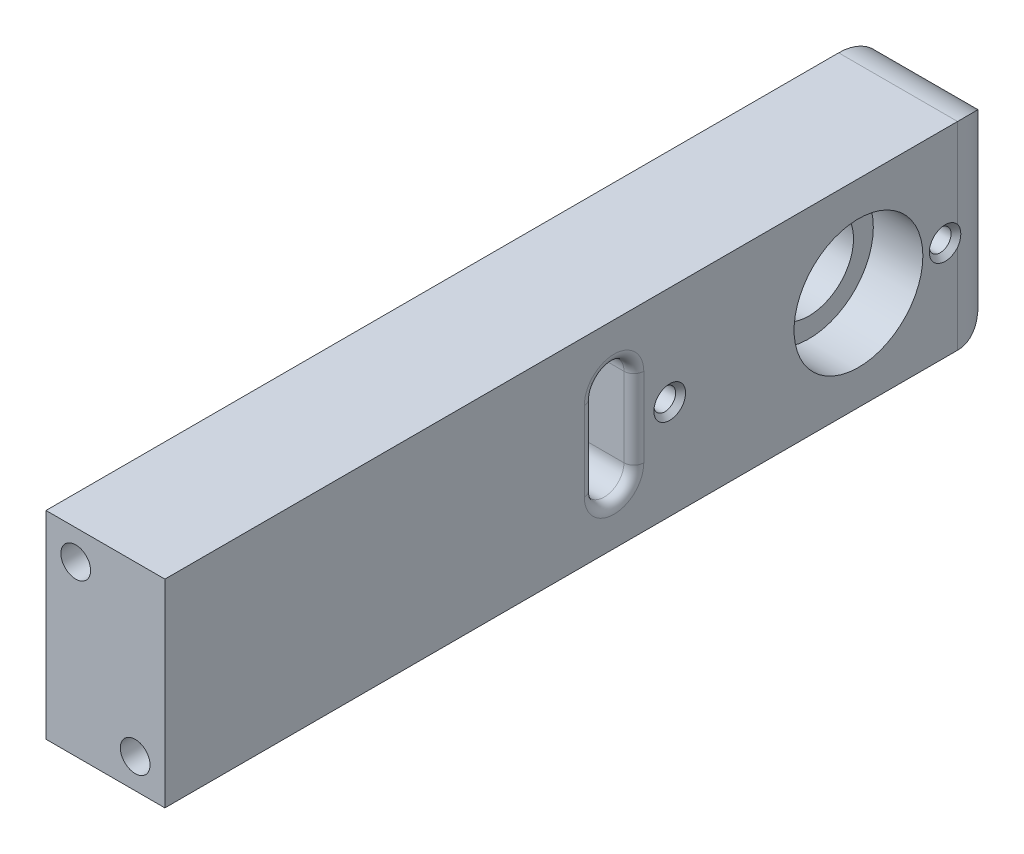
from build123d import *

# Parameters (mm, degrees)
SZKIC1_W                    = 12
SZKIC1_H                    = 20
DODANIE_WYCI_GNI_CIE1_DEPTH = 85
SZKIC2_R                    = 1.5
WYTNIJ_WYCI_GNI_CIE1_DEPTH  = 10
SZKIC4_R                    = 6.5
WYTNIJ_WYCI_GNI_CIE2_DEPTH  = 5
SZKIC5_R                    = 4.5
WYTNIJ_WYCI_GNI_CIE3_DEPTH  = 87.423376467
SZKIC6_R                    = 1.1
WYTNIJ_WYCI_GNI_CIE4_DEPTH  = 87.423376467
SFAZOWANIE1_SIZE            = 0.5
SZKIC7_R                    = 1.1
WYTNIJ_WYCI_GNI_CIE5_DEPTH  = 87.423376467
SFAZOWANIE2_SIZE            = 0.5
ZAOKR_GLENIE1_R             = 5
WYTNIJ_WYCI_GNI_CIE6_DEPTH  = 87.423376493
ZAOKR_GLENIE2_R             = 1


with BuildPart() as part:
    # Szkic1 → Dodanie-wyciągnięcie1 (new body)
    with BuildSketch(Plane.XY):
        Rectangle(SZKIC1_W, SZKIC1_H)
    extrude(amount=DODANIE_WYCI_GNI_CIE1_DEPTH)

    # Szkic2 → Wytnij-wyciągnięcie1 (cut)
    with BuildSketch(Plane.XY.offset(85)):
        with Locations((-3, 7)):
            Circle(SZKIC2_R)
        with Locations((3, -7)):
            Circle(SZKIC2_R)
    extrude(amount=-WYTNIJ_WYCI_GNI_CIE1_DEPTH, mode=Mode.SUBTRACT)

    # Szkic4 → Wytnij-wyciągnięcie2 (cut)
    with BuildSketch(Plane(origin=(6, 0, 0), x_dir=(0, 0, -1), z_dir=(1, 0, 0))):
        with Locations((-15, 0)):
            Circle(SZKIC4_R)
    extrude(amount=-WYTNIJ_WYCI_GNI_CIE2_DEPTH, mode=Mode.SUBTRACT)

    # Szkic5 → Wytnij-wyciągnięcie3 (cut, through all)
    with BuildSketch(Plane.ZY.offset(6)):
        with Locations((15, 0)):
            Circle(SZKIC5_R)
    extrude(amount=-WYTNIJ_WYCI_GNI_CIE3_DEPTH, mode=Mode.SUBTRACT)

    # Szkic6 → Wytnij-wyciągnięcie4 (cut, through all)
    with BuildSketch(Plane.ZY.offset(6)):
        with Locations((34.05, 0)):
            Circle(SZKIC6_R)
    extrude(amount=-WYTNIJ_WYCI_GNI_CIE4_DEPTH, mode=Mode.SUBTRACT)

    # Sfazowanie1
    sfazowanie1_edges = [part.edges().sort_by_distance(p)[0] for p in [
        (6, 0, 32.95),
    ]]
    chamfer(sfazowanie1_edges, length=SFAZOWANIE1_SIZE)

    # Szkic7 → Wytnij-wyciągnięcie5 (cut, through all)
    with BuildSketch(Plane.ZY.offset(6)):
        with Locations((6.25, 0)):
            Circle(SZKIC7_R)
    extrude(amount=-WYTNIJ_WYCI_GNI_CIE5_DEPTH, mode=Mode.SUBTRACT)

    # Sfazowanie2
    sfazowanie2_edges = [part.edges().sort_by_distance(p)[0] for p in [
        (6, 0, 5.15),
    ]]
    chamfer(sfazowanie2_edges, length=SFAZOWANIE2_SIZE)

    # Zaokrąglenie1
    # the kernel refuses this fillet: 5 mm, written as the material it takes off along each edge
    with BuildSketch(Plane(origin=(-18.5, -10, 0), x_dir=(0, 0, 1), z_dir=(1, 0, 0))) as zaokr_glenie1_piece_1:
        with BuildLine():
            CenterArc((ZAOKR_GLENIE1_R, -ZAOKR_GLENIE1_R), ZAOKR_GLENIE1_R, 90, 90)
            Line((0, -ZAOKR_GLENIE1_R), (0, 0))
            Line((0, 0), (ZAOKR_GLENIE1_R, 0))
        make_face()
    extrude(amount=37, mode=Mode.SUBTRACT)
    with BuildSketch(Plane(origin=(18.5, 10, 0), x_dir=(0, -1, 0), z_dir=(-1, 0, 0))) as zaokr_glenie1_piece_2:
        with BuildLine():
            CenterArc((ZAOKR_GLENIE1_R, ZAOKR_GLENIE1_R), ZAOKR_GLENIE1_R, 180, 90)
            Line((0, ZAOKR_GLENIE1_R), (0, 0))
            Line((0, 0), (ZAOKR_GLENIE1_R, 0))
        make_face()
    extrude(amount=37, mode=Mode.SUBTRACT)
    with BuildSketch(Plane(origin=(6, -22.5, 0), x_dir=(0, 0, 1), z_dir=(0, 1, 0))) as zaokr_glenie1_piece_3:
        with BuildLine():
            CenterArc((ZAOKR_GLENIE1_R, -ZAOKR_GLENIE1_R), ZAOKR_GLENIE1_R, 90, 90)
            Line((0, -ZAOKR_GLENIE1_R), (0, 0))
            Line((0, 0), (ZAOKR_GLENIE1_R, 0))
        make_face()
    extrude(amount=45, mode=Mode.SUBTRACT)

    # Szkic8 → Wytnij-wyciągnięcie6 (cut, through all)
    with BuildSketch(Plane.ZY.offset(6)):
        with BuildLine():
            Line((37.668037351, -4), (37.668037351, 4))
            ThreePointArc((37.668037351, 4), (39.668037351, 6), (41.668037351, 4))
            Line((41.668037351, 4), (41.668037351, -4))
            ThreePointArc((41.668037351, -4), (39.668037351, -6), (37.668037351, -4))
        make_face()
    extrude(amount=-WYTNIJ_WYCI_GNI_CIE6_DEPTH, mode=Mode.SUBTRACT)

    # Zaokrąglenie2
    zaokr_glenie2_edges = [part.edges().sort_by_distance(p)[0] for p in [
        (6, -6, 39.668037351),
        (6, 0, 37.668037351),
        (6, 6, 39.668037351),
        (6, 0, 41.668037351),
        (-6, -6, 39.668037351),
        (-6, 0, 41.668037351),
        (-6, 6, 39.668037351),
        (-6, 0, 37.668037351),
    ]]
    fillet(zaokr_glenie2_edges, radius=ZAOKR_GLENIE2_R)


solid = part.part
